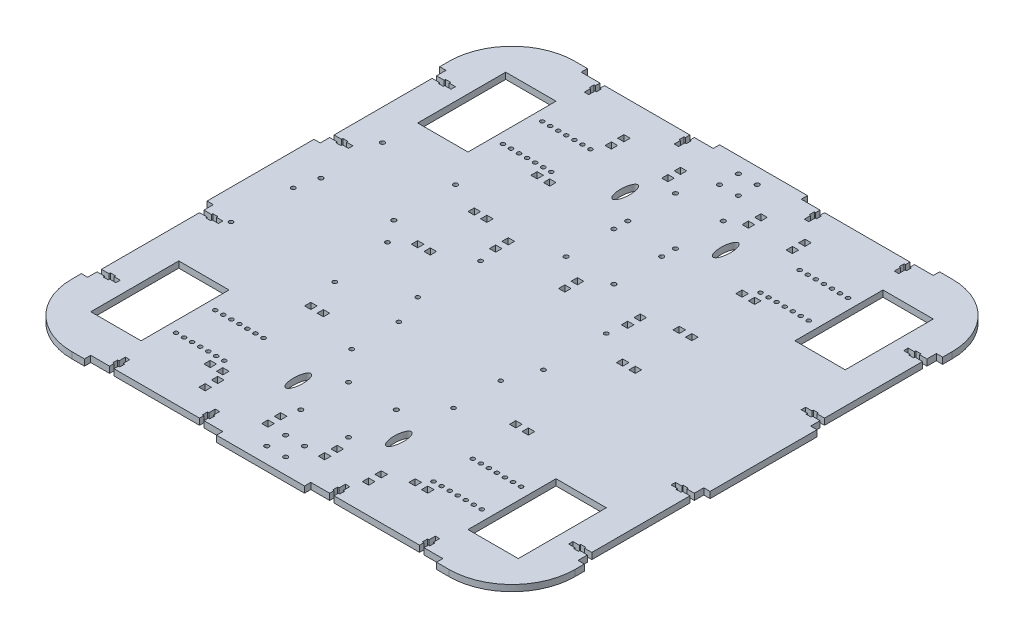
from build123d import *

# Parameters (mm, degrees)
SKETCH1_W           = 400
SKETCH1_H           = 400
SKETCH1_R           = 1.75
SKETCH1_W_2         = 40
SKETCH1_H_2         = 70
BOSS_EXTRUDE2_DEPTH = 5
FILLET1_R           = 50
SKETCH2_R           = 1.6
CUT_EXTRUDE1_DEPTH  = 5
SKETCH3_R           = 1.65
CUT_EXTRUDE2_DEPTH  = 10
SKETCH4_R           = 1.75
CUT_EXTRUDE3_DEPTH  = 10
SKETCH5_R           = 1.75
CUT_EXTRUDE4_DEPTH  = 10
SKETCH6_RX          = 10
SKETCH6_RY          = 3.75
CUT_EXTRUDE5_DEPTH  = 10
SKETCH7_R           = 1.65
CUT_EXTRUDE6_DEPTH  = 10
SKETCH8_R           = 1.65
CUT_EXTRUDE7_DEPTH  = 5
CUT_EXTRUDE8_DEPTH  = 10
SKETCH11_W          = 105
SKETCH11_H          = 5
CUT_EXTRUDE9_DEPTH  = 10
CUT_EXTRUDE10_DEPTH = 5
SKETCH13_W          = 5
SKETCH13_H          = 100
CUT_EXTRUDE11_DEPTH = 5
SKETCH14_W          = 5
SKETCH14_H          = 5
CUT_EXTRUDE12_DEPTH = 10


with BuildPart() as part:
    # Sketch1 → Boss-Extrude2 (new body)
    with BuildSketch(Plane(origin=(0, 0, 0), x_dir=(1, 0, 0), z_dir=(0, 1, 0))):
        Rectangle(SKETCH1_W, SKETCH1_H)
        with Locations((-7.5, 172.5)):
            Circle(SKETCH1_R, mode=Mode.SUBTRACT)
        with Locations((-7.5, 187.5)):
            Circle(SKETCH1_R, mode=Mode.SUBTRACT)
        with Locations((7.5, 172.5)):
            Circle(SKETCH1_R, mode=Mode.SUBTRACT)
        with Locations((7.5, 187.5)):
            Circle(SKETCH1_R, mode=Mode.SUBTRACT)
        with Locations((-150, -130)):
            Rectangle(SKETCH1_W_2, SKETCH1_H_2, mode=Mode.SUBTRACT)
        with Locations((150, -130)):
            Rectangle(SKETCH1_W_2, SKETCH1_H_2, mode=Mode.SUBTRACT)
        with Locations((-150, 130)):
            Rectangle(SKETCH1_W_2, SKETCH1_H_2, mode=Mode.SUBTRACT)
        with Locations((150, 130)):
            Rectangle(SKETCH1_W_2, SKETCH1_H_2, mode=Mode.SUBTRACT)
        with Locations((-7.5, -187.5)):
            Circle(SKETCH1_R, mode=Mode.SUBTRACT)
        with Locations((-7.5, -172.5)):
            Circle(SKETCH1_R, mode=Mode.SUBTRACT)
        with Locations((7.5, -187.5)):
            Circle(SKETCH1_R, mode=Mode.SUBTRACT)
        with Locations((7.5, -172.5)):
            Circle(SKETCH1_R, mode=Mode.SUBTRACT)
    extrude(amount=BOSS_EXTRUDE2_DEPTH)

    # Fillet1
    fillet1_edges = [part.edges().sort_by_distance(p)[0] for p in [
        (200, 2.5, -200),
        (200, 2.5, 200),
        (-200, 2.5, 200),
        (-200, 2.5, -200),
    ]]
    fillet(fillet1_edges, radius=FILLET1_R)

    # Sketch2 → Cut-Extrude1 (cut)
    with BuildSketch(Plane(origin=(0, 5, 0), x_dir=(1, 0, 0), z_dir=(0, 1, 0))):
        with Locations((-121.6, 145.6)):
            Circle(SKETCH2_R)
        with Locations((-115.2, 145.6)):
            Circle(SKETCH2_R)
        with Locations((-108.8, 145.6)):
            Circle(SKETCH2_R)
        with Locations((-102.4, 145.6)):
            Circle(SKETCH2_R)
        with Locations((-96, 145.6)):
            Circle(SKETCH2_R)
        with Locations((-89.6, 145.6)):
            Circle(SKETCH2_R)
        with Locations((-83.2, 145.6)):
            Circle(SKETCH2_R)
        with Locations((-83.2, 114.4)):
            Circle(SKETCH2_R)
        with Locations((-89.6, 114.4)):
            Circle(SKETCH2_R)
        with Locations((-96, 114.4)):
            Circle(SKETCH2_R)
        with Locations((-102.4, 114.4)):
            Circle(SKETCH2_R)
        with Locations((-108.8, 114.4)):
            Circle(SKETCH2_R)
        with Locations((-115.2, 114.4)):
            Circle(SKETCH2_R)
        with Locations((-121.6, 114.4)):
            Circle(SKETCH2_R)
        with Locations((83.2, 114.4)):
            Circle(SKETCH2_R)
        with Locations((89.6, 114.4)):
            Circle(SKETCH2_R)
        with Locations((96, 114.4)):
            Circle(SKETCH2_R)
        with Locations((102.4, 114.4)):
            Circle(SKETCH2_R)
        with Locations((108.8, 114.4)):
            Circle(SKETCH2_R)
        with Locations((115.2, 114.4)):
            Circle(SKETCH2_R)
        with Locations((121.6, 114.4)):
            Circle(SKETCH2_R)
        with Locations((83.2, 145.6)):
            Circle(SKETCH2_R)
        with Locations((89.6, 145.6)):
            Circle(SKETCH2_R)
        with Locations((96, 145.6)):
            Circle(SKETCH2_R)
        with Locations((102.4, 145.6)):
            Circle(SKETCH2_R)
        with Locations((108.8, 145.6)):
            Circle(SKETCH2_R)
        with Locations((115.2, 145.6)):
            Circle(SKETCH2_R)
        with Locations((121.6, 145.6)):
            Circle(SKETCH2_R)
        with Locations((121.6, -145.6)):
            Circle(SKETCH2_R)
        with Locations((115.2, -145.6)):
            Circle(SKETCH2_R)
        with Locations((108.8, -145.6)):
            Circle(SKETCH2_R)
        with Locations((102.4, -145.6)):
            Circle(SKETCH2_R)
        with Locations((96, -145.6)):
            Circle(SKETCH2_R)
        with Locations((89.6, -145.6)):
            Circle(SKETCH2_R)
        with Locations((83.2, -145.6)):
            Circle(SKETCH2_R)
        with Locations((121.6, -114.4)):
            Circle(SKETCH2_R)
        with Locations((115.2, -114.4)):
            Circle(SKETCH2_R)
        with Locations((108.8, -114.4)):
            Circle(SKETCH2_R)
        with Locations((102.4, -114.4)):
            Circle(SKETCH2_R)
        with Locations((96, -114.4)):
            Circle(SKETCH2_R)
        with Locations((89.6, -114.4)):
            Circle(SKETCH2_R)
        with Locations((83.2, -114.4)):
            Circle(SKETCH2_R)
        with Locations((-121.6, -114.4)):
            Circle(SKETCH2_R)
        with Locations((-115.2, -114.4)):
            Circle(SKETCH2_R)
        with Locations((-108.8, -114.4)):
            Circle(SKETCH2_R)
        with Locations((-102.4, -114.4)):
            Circle(SKETCH2_R)
        with Locations((-96, -114.4)):
            Circle(SKETCH2_R)
        with Locations((-89.6, -114.4)):
            Circle(SKETCH2_R)
        with Locations((-83.2, -114.4)):
            Circle(SKETCH2_R)
        with Locations((-83.2, -145.6)):
            Circle(SKETCH2_R)
        with Locations((-89.6, -145.6)):
            Circle(SKETCH2_R)
        with Locations((-96, -145.6)):
            Circle(SKETCH2_R)
        with Locations((-102.4, -145.6)):
            Circle(SKETCH2_R)
        with Locations((-108.8, -145.6)):
            Circle(SKETCH2_R)
        with Locations((-115.2, -145.6)):
            Circle(SKETCH2_R)
        with Locations((-121.6, -145.6)):
            Circle(SKETCH2_R)
    extrude(amount=-CUT_EXTRUDE1_DEPTH, mode=Mode.SUBTRACT)

    # Sketch3 → Cut-Extrude2 (cut)
    with BuildSketch(Plane(origin=(0, 5, 0), x_dir=(1, 0, 0), z_dir=(0, 1, 0))):
        with Locations((-176.03, -47.46)):
            Circle(SKETCH3_R)
        with Locations((-174.76, 0.8)):
            Circle(SKETCH3_R)
        with Locations((-93.48, -47.46)):
            Circle(SKETCH3_R)
        with Locations((-99.83, 0.8)):
            Circle(SKETCH3_R)
    extrude(amount=-CUT_EXTRUDE2_DEPTH, mode=Mode.SUBTRACT)

    # Sketch4 → Cut-Extrude3 (cut)
    with BuildSketch(Plane(origin=(0, 5, 0), x_dir=(1, 0, 0), z_dir=(0, 1, 0))):
        with Locations((-19, 149)):
            Circle(SKETCH4_R)
        with Locations((19, 149)):
            Circle(SKETCH4_R)
        with Locations((19, 111)):
            Circle(SKETCH4_R)
        with Locations((-19, 111)):
            Circle(SKETCH4_R)
        with Locations((-19, 100)):
            Circle(SKETCH4_R)
        with Locations((19, 100)):
            Circle(SKETCH4_R)
        with Locations((19, 62)):
            Circle(SKETCH4_R)
        with Locations((-19, 62)):
            Circle(SKETCH4_R)
        with Locations((-19, -149)):
            Circle(SKETCH4_R)
        with Locations((19, -149)):
            Circle(SKETCH4_R)
        with Locations((-19, -111)):
            Circle(SKETCH4_R)
        with Locations((19, -111)):
            Circle(SKETCH4_R)
    extrude(amount=-CUT_EXTRUDE3_DEPTH, mode=Mode.SUBTRACT)

    # Sketch5 → Cut-Extrude4 (cut)
    with BuildSketch(Plane(origin=(0, 5, 0), x_dir=(1, 0, 0), z_dir=(0, 1, 0))):
        with Locations((-170.5, 67.5)):
            Circle(SKETCH5_R)
        with Locations((-112.5, 67.5)):
            Circle(SKETCH5_R)
        with Locations((-112.5, 18.5)):
            Circle(SKETCH5_R)
        with Locations((-170.5, 18.5)):
            Circle(SKETCH5_R)
    extrude(amount=-CUT_EXTRUDE4_DEPTH, mode=Mode.SUBTRACT)

    # Sketch6 → Cut-Extrude5 (cut)
    with BuildSketch(Plane(origin=(0, 5, 0), x_dir=(1, 0, 0), z_dir=(0, 1, 0))):
        with Locations(Location((-40, 130), (0, 0, 90))):
            Ellipse(SKETCH6_RX, SKETCH6_RY)
        with Locations(Location((40, 130), (0, 0, 90))):
            Ellipse(SKETCH6_RX, SKETCH6_RY)
        with Locations(Location((40, -130), (0, 0, -90))):
            Ellipse(SKETCH6_RX, SKETCH6_RY)
        with Locations(Location((-40, -130), (0, 0, -90))):
            Ellipse(SKETCH6_RX, SKETCH6_RY)
    extrude(amount=-CUT_EXTRUDE5_DEPTH, mode=Mode.SUBTRACT)

    # Sketch7 → Cut-Extrude6 (cut)
    with BuildSketch(Plane(origin=(0, 5, 0), x_dir=(1, 0, 0), z_dir=(0, 1, 0))):
        with Locations((-50, 25)):
            Circle(SKETCH7_R)
        with Locations((50, 25)):
            Circle(SKETCH7_R)
        with Locations((50, -25)):
            Circle(SKETCH7_R)
        with Locations((-50, -25)):
            Circle(SKETCH7_R)
    extrude(amount=-CUT_EXTRUDE6_DEPTH, mode=Mode.SUBTRACT)

    # Sketch8 → Cut-Extrude7 (cut)
    with BuildSketch(Plane(origin=(0, 5, 0), x_dir=(1, 0, 0), z_dir=(0, 1, 0))):
        with Locations((-40.5, -49.5)):
            Circle(SKETCH8_R)
        with Locations((40.5, -49.5)):
            Circle(SKETCH8_R)
        with Locations((40.5, -87)):
            Circle(SKETCH8_R)
        with Locations((-40.5, -87)):
            Circle(SKETCH8_R)
    extrude(amount=-CUT_EXTRUDE7_DEPTH, mode=Mode.SUBTRACT)

    # Sketch10 → Cut-Extrude8 (cut)
    with BuildSketch(Plane(origin=(0, 5, 0), x_dir=(1, 0, 0), z_dir=(0, 1, 0))):
        Polygon((-125, -200), (-121.5, -200), (-121.5, -191.5), (-120.4, -191.5), (-120.4, -187.5), (-121.5, -187.5), (-121.5, -182.5), (-125, -182.5), (-125, -187.5), (-126.1, -187.5), (-126.1, -191.5), (-125, -191.5), align=None)
        Polygon((-53.5, -200), (-50, -200), (-50, -191.5), (-48.9, -191.5), (-48.9, -187.5), (-50, -187.5), (-50, -182.5), (-53.5, -182.5), (-53.5, -187.5), (-54.6, -187.5), (-54.6, -191.5), (-53.5, -191.5), align=None)
        Polygon((125, -200), (125, -191.5), (126.1, -191.5), (126.1, -187.5), (125, -187.5), (125, -182.5), (121.5, -182.5), (121.5, -187.5), (120.4, -187.5), (120.4, -191.5), (121.5, -191.5), (121.5, -200), align=None)
        Polygon((53.5, -200), (53.5, -191.5), (54.6, -191.5), (54.6, -187.5), (53.5, -187.5), (53.5, -182.5), (50, -182.5), (50, -187.5), (48.9, -187.5), (48.9, -191.5), (50, -191.5), (50, -200), align=None)
        Polygon((125, 200), (121.5, 200), (121.5, 191.5), (120.4, 191.5), (120.4, 187.5), (121.5, 187.5), (121.5, 182.5), (125, 182.5), (125, 187.5), (126.1, 187.5), (126.1, 191.5), (125, 191.5), align=None)
        Polygon((53.5, 200), (50, 200), (50, 191.5), (48.9, 191.5), (48.9, 187.5), (50, 187.5), (50, 182.5), (53.5, 182.5), (53.5, 187.5), (54.6, 187.5), (54.6, 191.5), (53.5, 191.5), align=None)
        Polygon((-53.5, 200), (-53.5, 191.5), (-54.6, 191.5), (-54.6, 187.5), (-53.5, 187.5), (-53.5, 182.5), (-50, 182.5), (-50, 187.5), (-48.9, 187.5), (-48.9, 191.5), (-50, 191.5), (-50, 200), align=None)
        Polygon((-125, 200), (-125, 191.5), (-126.1, 191.5), (-126.1, 187.5), (-125, 187.5), (-125, 182.5), (-121.5, 182.5), (-121.5, 187.5), (-120.4, 187.5), (-120.4, 191.5), (-121.5, 191.5), (-121.5, 200), align=None)
    extrude(amount=-CUT_EXTRUDE8_DEPTH, mode=Mode.SUBTRACT)

    # Sketch11 → Cut-Extrude9 (cut)
    with BuildSketch(Plane(origin=(0, 5, 0), x_dir=(1, 0, 0), z_dir=(0, 1, 0))):
        with Locations((-87.5, -197.5)):
            Rectangle(SKETCH11_W, SKETCH11_H)
        with Locations((87.5, -197.5)):
            Rectangle(SKETCH11_W, SKETCH11_H)
        with Locations((87.5, 197.5)):
            Rectangle(SKETCH11_W, SKETCH11_H)
        with Locations((-87.5, 197.5)):
            Rectangle(SKETCH11_W, SKETCH11_H)
    extrude(amount=-CUT_EXTRUDE9_DEPTH, mode=Mode.SUBTRACT)

    # Sketch12 → Cut-Extrude10 (cut)
    with BuildSketch(Plane(origin=(0, 5, 0), x_dir=(1, 0, 0), z_dir=(0, 1, 0))):
        Polygon((-200, 135), (-189, 135), (-189, 136.1), (-185, 136.1), (-185, 135), (-180, 135), (-180, 131.5), (-185, 131.5), (-185, 130.4), (-189, 130.4), (-189, 131.5), (-200, 131.5), align=None)
        Polygon((-200, 53.5), (-189, 53.5), (-189, 54.6), (-185, 54.6), (-185, 53.5), (-180, 53.5), (-180, 50), (-185, 50), (-185, 48.9), (-189, 48.9), (-189, 50), (-200, 50), align=None)
        Polygon((-200, -53.5), (-200, -50), (-189, -50), (-189, -48.9), (-185, -48.9), (-185, -50), (-180, -50), (-180, -53.5), (-185, -53.5), (-185, -54.6), (-189, -54.6), (-189, -53.5), align=None)
        Polygon((-200, -135), (-200, -131.5), (-189, -131.5), (-189, -130.4), (-185, -130.4), (-185, -131.5), (-180, -131.5), (-180, -135), (-185, -135), (-185, -136.1), (-189, -136.1), (-189, -135), align=None)
        Polygon((200, -135), (189, -135), (189, -136.1), (185, -136.1), (185, -135), (180, -135), (180, -131.5), (185, -131.5), (185, -130.4), (189, -130.4), (189, -131.5), (200, -131.5), align=None)
        Polygon((200, -53.5), (189, -53.5), (189, -54.6), (185, -54.6), (185, -53.5), (180, -53.5), (180, -50), (185, -50), (185, -48.9), (189, -48.9), (189, -50), (200, -50), align=None)
        Polygon((200, 53.5), (200, 50), (189, 50), (189, 48.9), (185, 48.9), (185, 50), (180, 50), (180, 53.5), (185, 53.5), (185, 54.6), (189, 54.6), (189, 53.5), align=None)
        Polygon((200, 135), (200, 131.5), (189, 131.5), (189, 130.4), (185, 130.4), (185, 131.5), (180, 131.5), (180, 135), (185, 135), (185, 136.1), (189, 136.1), (189, 135), align=None)
    extrude(amount=-CUT_EXTRUDE10_DEPTH, mode=Mode.SUBTRACT)

    # Sketch13 → Cut-Extrude11 (cut)
    with BuildSketch(Plane(origin=(0, 5, 0), x_dir=(1, 0, 0), z_dir=(0, 1, 0))):
        with Locations((-197.5, 92.5)):
            Rectangle(SKETCH13_W, SKETCH13_H)
        with Locations((-197.5, -92.5)):
            Rectangle(SKETCH13_W, SKETCH13_H)
        with Locations((197.5, -92.5)):
            Rectangle(SKETCH13_W, SKETCH13_H)
        with Locations((197.5, 92.5)):
            Rectangle(SKETCH13_W, SKETCH13_H)
    extrude(amount=-CUT_EXTRUDE11_DEPTH, mode=Mode.SUBTRACT)

    # Sketch14 → Cut-Extrude12 (cut)
    with BuildSketch(Plane(origin=(0, 5, 0), x_dir=(1, 0, 0), z_dir=(0, 1, 0))):
        with Locations((31.5, 166.5)):
            Rectangle(SKETCH14_W, SKETCH14_H)
        with Locations((31.5, 156.5)):
            Rectangle(SKETCH14_W, SKETCH14_H)
        with Locations((66.5, 166.5)):
            Rectangle(SKETCH14_W, SKETCH14_H)
        with Locations((66.5, 156.5)):
            Rectangle(SKETCH14_W, SKETCH14_H)
        with Locations((2.5, 49.5)):
            Rectangle(SKETCH14_W, SKETCH14_H)
        with Locations((2.5, 39.5)):
            Rectangle(SKETCH14_W, SKETCH14_H)
        with Locations((52.5, 49.5)):
            Rectangle(SKETCH14_W, SKETCH14_H)
        with Locations((52.5, 39.5)):
            Rectangle(SKETCH14_W, SKETCH14_H)
        with Locations((22.5, -161.5)):
            Rectangle(SKETCH14_W, SKETCH14_H)
        with Locations((22.5, -171.5)):
            Rectangle(SKETCH14_W, SKETCH14_H)
        with Locations((57.5, -161.5)):
            Rectangle(SKETCH14_W, SKETCH14_H)
        with Locations((57.5, -171.5)):
            Rectangle(SKETCH14_W, SKETCH14_H)
        with Locations((-32.5, 166.5)):
            Rectangle(SKETCH14_W, SKETCH14_H)
        with Locations((-32.5, 156.5)):
            Rectangle(SKETCH14_W, SKETCH14_H)
        with Locations((-52.5, 49.5)):
            Rectangle(SKETCH14_W, SKETCH14_H)
        with Locations((-52.5, 39.5)):
            Rectangle(SKETCH14_W, SKETCH14_H)
        with Locations((-22.5, -161.5)):
            Rectangle(SKETCH14_W, SKETCH14_H)
        with Locations((-22.5, -171.5)):
            Rectangle(SKETCH14_W, SKETCH14_H)
        with Locations((-77.5, 166.5)):
            Rectangle(SKETCH14_W, SKETCH14_H)
        with Locations((-77.5, 156.5)):
            Rectangle(SKETCH14_W, SKETCH14_H)
        with Locations((-72.5, -161.5)):
            Rectangle(SKETCH14_W, SKETCH14_H)
        with Locations((-72.5, -171.5)):
            Rectangle(SKETCH14_W, SKETCH14_H)
        with Locations((76.5, -153.5)):
            Rectangle(SKETCH14_W, SKETCH14_H)
        with Locations((86.5, -153.5)):
            Rectangle(SKETCH14_W, SKETCH14_H)
        with Locations((76.5, -73.5)):
            Rectangle(SKETCH14_W, SKETCH14_H)
        with Locations((86.5, -73.5)):
            Rectangle(SKETCH14_W, SKETCH14_H)
        with Locations((76.5, 11.5)):
            Rectangle(SKETCH14_W, SKETCH14_H)
        with Locations((86.5, 11.5)):
            Rectangle(SKETCH14_W, SKETCH14_H)
        with Locations((76.5, 56.5)):
            Rectangle(SKETCH14_W, SKETCH14_H)
        with Locations((86.5, 56.5)):
            Rectangle(SKETCH14_W, SKETCH14_H)
        with Locations((76.5, 106.5)):
            Rectangle(SKETCH14_W, SKETCH14_H)
        with Locations((86.5, 106.5)):
            Rectangle(SKETCH14_W, SKETCH14_H)
        with Locations((-76.5, 106.5)):
            Rectangle(SKETCH14_W, SKETCH14_H)
        with Locations((-86.5, 106.5)):
            Rectangle(SKETCH14_W, SKETCH14_H)
        with Locations((-76.5, 56.5)):
            Rectangle(SKETCH14_W, SKETCH14_H)
        with Locations((-86.5, 56.5)):
            Rectangle(SKETCH14_W, SKETCH14_H)
        with Locations((-76.5, 11.5)):
            Rectangle(SKETCH14_W, SKETCH14_H)
        with Locations((-86.5, 11.5)):
            Rectangle(SKETCH14_W, SKETCH14_H)
        with Locations((-76.5, -73.5)):
            Rectangle(SKETCH14_W, SKETCH14_H)
        with Locations((-86.5, -73.5)):
            Rectangle(SKETCH14_W, SKETCH14_H)
        with Locations((-76.5, -153.5)):
            Rectangle(SKETCH14_W, SKETCH14_H)
        with Locations((-86.5, -153.5)):
            Rectangle(SKETCH14_W, SKETCH14_H)
    extrude(amount=-CUT_EXTRUDE12_DEPTH, mode=Mode.SUBTRACT)


solid = part.part
